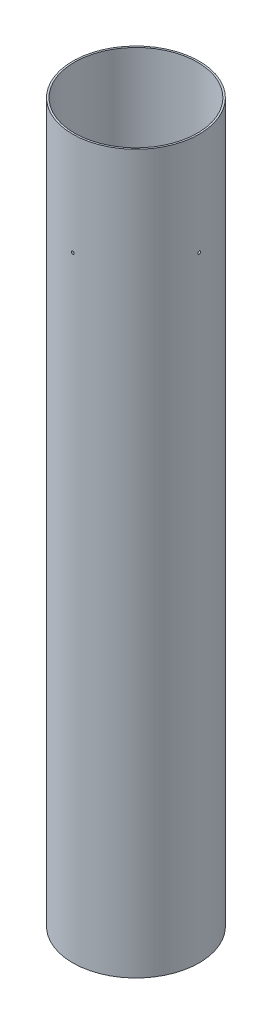
from build123d import *

# Parameters (mm, degrees)
SKETCH1_R           = 78.359
SKETCH1_R_2         = 76.2
BOSS_EXTRUDE1_DEPTH = 889
SKETCH3_R           = 1.750000056
CUT_EXTRUDE1_DEPTH  = 896.880162612
CIRPATTERN1_COUNT   = 4


with BuildPart() as part:
    # Sketch1 → Boss-Extrude1 (new body)
    with BuildSketch(Plane(origin=(0, 0, 0), x_dir=(1, 0, 0), z_dir=(0, 1, 0))):
        Circle(SKETCH1_R)
        Circle(SKETCH1_R_2, mode=Mode.SUBTRACT)
    extrude(amount=BOSS_EXTRUDE1_DEPTH)

    # Sketch3 → Cut-Extrude1 (cut, through all)
    with BuildSketch(Plane.XY):
        with Locations((0, 762)):
            Circle(SKETCH3_R)
    cut_extrude1 = extrude(amount=-CUT_EXTRUDE1_DEPTH, mode=Mode.SUBTRACT)

    # CirPattern1: Cut-Extrude1 ×4 about axis
    cirpattern1_axis = Axis((0, 889, 0), (0, -1, 0))
    for i in range(1, CIRPATTERN1_COUNT):
        add(cut_extrude1.rotate(cirpattern1_axis, i * 360 / CIRPATTERN1_COUNT), mode=Mode.SUBTRACT)


solid = part.part
